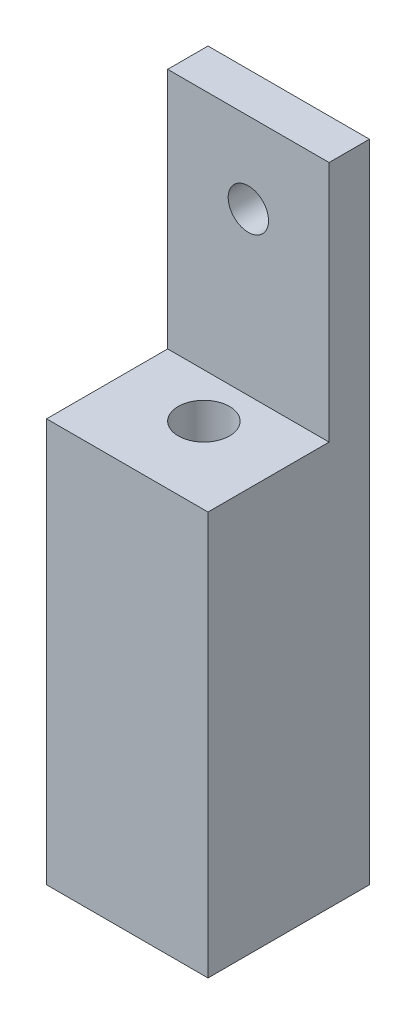
from build123d import *

# Parameters (mm, degrees)
SKETCH1_W           = 20
SKETCH1_H           = 20
SKETCH1_R           = 3.175
BOSS_EXTRUDE1_DEPTH = 25
SKETCH2_W           = 20
SKETCH2_H           = 5
BOSS_EXTRUDE2_DEPTH = 30
SKETCH3_R           = 2.5
CUT_EXTRUDE1_DEPTH  = 58.879184514


with BuildPart() as part:
    # Sketch1 → Boss-Extrude1 (new, symmetric)
    with BuildSketch(Plane(origin=(0, 0, 0), x_dir=(1, 0, 0), z_dir=(0, 1, 0))):
        Rectangle(SKETCH1_W, SKETCH1_H)
        with Locations((0, -0.51)):
            Circle(SKETCH1_R, mode=Mode.SUBTRACT)
    extrude(amount=BOSS_EXTRUDE1_DEPTH, both=True)

    # Sketch2 → Boss-Extrude2 (add)
    with BuildSketch(Plane(origin=(0, 25, 0), x_dir=(1, 0, 0), z_dir=(0, 1, 0))):
        with Locations((0, 7.5)):
            Rectangle(SKETCH2_W, SKETCH2_H)
    extrude(amount=BOSS_EXTRUDE2_DEPTH)

    # Sketch3 → Cut-Extrude1 (cut, through all)
    with BuildSketch(Plane.XY.offset(-5)):
        with Locations((0, 45)):
            Circle(SKETCH3_R)
    extrude(amount=-CUT_EXTRUDE1_DEPTH, mode=Mode.SUBTRACT)


solid = part.part
